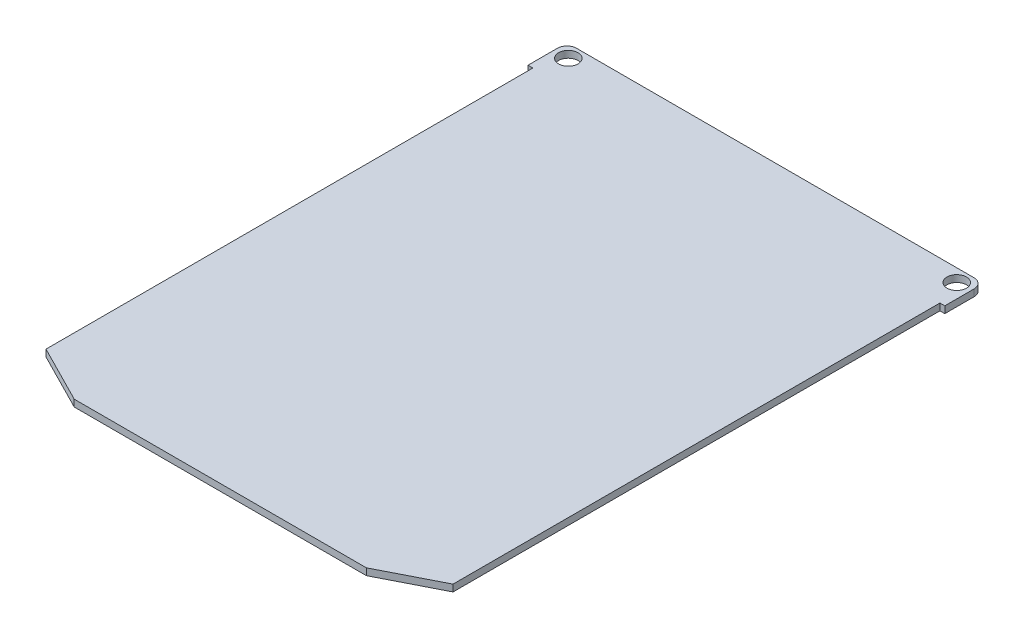
from build123d import *

# Parameters (mm, degrees)
SKETCH1_R           = 1
BOSS_EXTRUDE1_DEPTH = 0.7


with BuildPart() as part:
    # Sketch1 → Boss-Extrude1 (new body)
    with BuildSketch(Plane(origin=(0, 0, 0), x_dir=(1, 0, 0), z_dir=(0, 1, 0))):
        with BuildLine():
            Line((-21.4, 26.5), (-20.9, 26.5))
            Line((-20.9, 26.5), (-20.9, -23.5))
            Line((-20.9, -23.5), (-15, -26.5))
            Line((-15, -26.5), (15, -26.5))
            Line((15, -26.5), (20.9, -23.5))
            Line((20.9, -23.5), (20.9, 26.5))
            Line((20.9, 26.5), (21.4, 26.5))
            Line((21.4, 26.5), (21.4, 29.5))
            ThreePointArc((21.4, 29.5), (21.107106781, 30.207106781), (20.4, 30.5))
            Line((20.4, 30.5), (-20.4, 30.5))
            ThreePointArc((-20.4, 30.5), (-21.107106781, 30.207106781), (-21.4, 29.5))
            Line((-21.4, 29.5), (-21.4, 26.5))
        make_face()
        with Locations((-19.944365081, 29.181392426)):
            Circle(SKETCH1_R, mode=Mode.SUBTRACT)
        with Locations((19.944365081, 29.181392426)):
            Circle(SKETCH1_R, mode=Mode.SUBTRACT)
    extrude(amount=BOSS_EXTRUDE1_DEPTH)


solid = part.part
